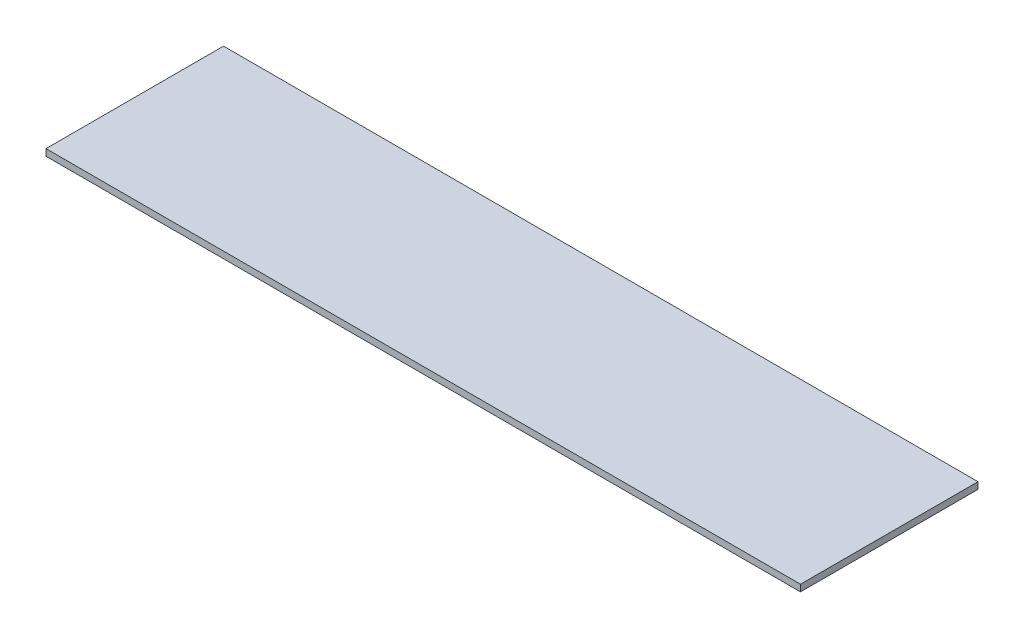
from build123d import *

# Parameters (mm, degrees)
SKETCH1_W           = 3400
SKETCH1_H           = 800
BOSS_EXTRUDE1_DEPTH = 30


with BuildPart() as part:
    # Sketch1 → Boss-Extrude1 (new body)
    with BuildSketch(Plane(origin=(0, 0, 0), x_dir=(1, 0, 0), z_dir=(0, 1, 0))):
        with Locations((-200, 50)):
            Rectangle(SKETCH1_W, SKETCH1_H)
    extrude(amount=BOSS_EXTRUDE1_DEPTH)


solid = part.part
